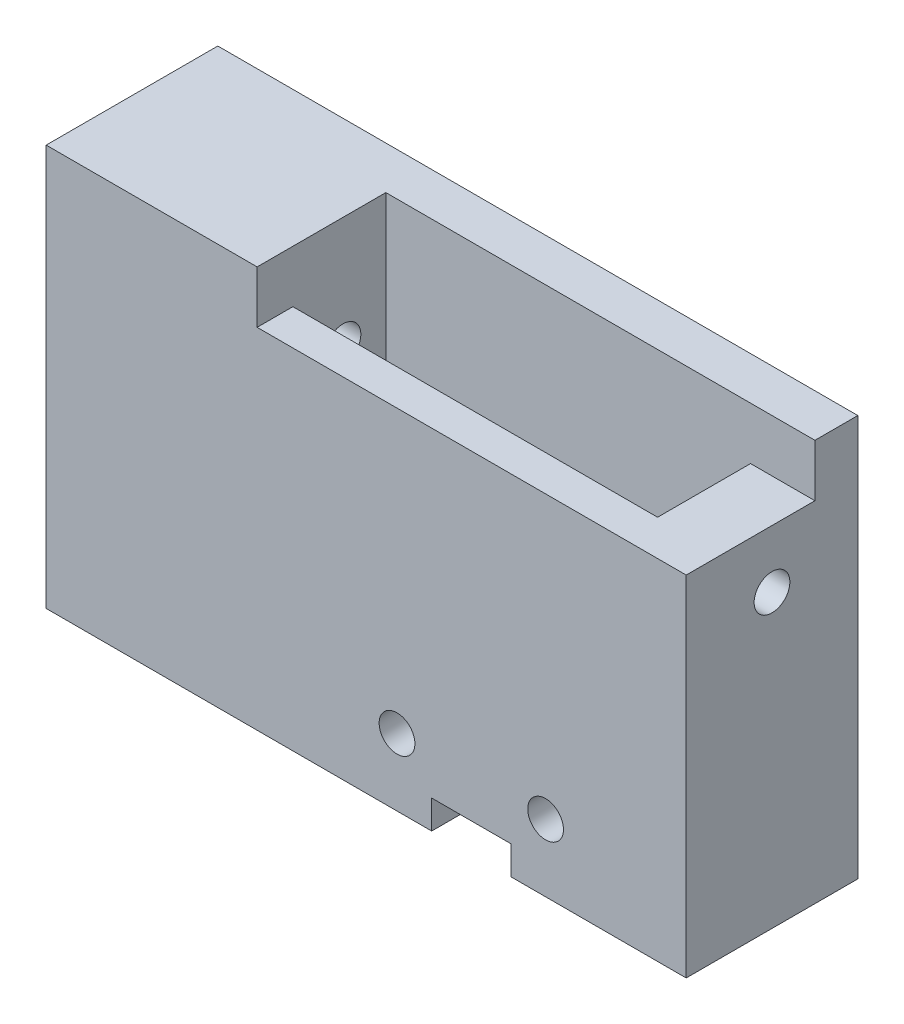
from build123d import *

# Parameters (mm, degrees)
SKETCH1_W              = 30
SKETCH1_H              = 24.4
BOSS_EXTRUDE1_DEPTH    = 3
SKETCH1_5_R            = 1.25
CUT_EXTRUDE1_DEPTH     = 6
BOSS_EXTRUDE3_START    = -3
BOSS_EXTRUDE3_DEPTH    = 3
SKETCH1_6_W            = 4.5
SKETCH1_6_H            = 11
SKETCH1_6_H_2          = 24.4
BOSS_EXTRUDE4_DEPTH    = 9
BOSS_EXTRUDE5_START    = -3
SKETCH2_6_W            = 14.75
SKETCH2_6_H            = 28.06
BOSS_EXTRUDE5_DEPTH    = 9
CUT_REVOLVE1_OUTLINE_W = 1.25
CUT_REVOLVE1_OUTLINE_H = 4.5
BOSS_EXTRUDE7_START    = 9
SKETCH1_7_W            = 2.25
SKETCH1_7_H            = 2
SKETCH1_7_W_2          = 6.505
SKETCH1_7_W_3          = 1.2
SKETCH1_7_W_4          = 6.495
SKETCH1_7_W_5          = 1.25
SKETCH1_7_R            = 1.25
BOSS_EXTRUDE7_DEPTH    = 2.5


# Read off the part's stored shape, not the designer's step: Cut-Revolve1
with BuildPart() as part:
    # Sketch1 → Boss-Extrude1 (new body)
    with BuildSketch(Plane.XY):
        with Locations((5.22, 7.5)):
            Rectangle(SKETCH1_W, SKETCH1_H)
    extrude(amount=-BOSS_EXTRUDE1_DEPTH)

    # Sketch1<5> → Cut-Extrude1 (cut)
    with BuildSketch(Plane.XY):
        Circle(SKETCH1_5_R)
        with Locations((10.39, 0)):
            Circle(SKETCH1_5_R)
    extrude(amount=-CUT_EXTRUDE1_DEPTH, mode=Mode.SUBTRACT)

    # Sketch2 → Boss-Extrude3 (add)
    with BuildSketch(Plane.XY.offset(3).offset(BOSS_EXTRUDE3_START)):
        Polygon((-9.78, -4.7), (-9.78, 16.91), (-4.78, 16.91), (-4.78, 19.7), (20.22, 19.7), (20.22, 23.36), (-24.53, 23.36), (-24.53, -4.7), align=None)
    extrude(amount=-BOSS_EXTRUDE3_DEPTH)

    # Sketch1<6> → Boss-Extrude4 (add)
    with BuildSketch(Plane.XY):
        with Locations((-7.53, 0.8)):
            Rectangle(SKETCH1_6_W, SKETCH1_6_H)
        with Locations((17.97, 7.5)):
            Rectangle(SKETCH1_6_W, SKETCH1_6_H_2)
    extrude(amount=BOSS_EXTRUDE4_DEPTH)

    # Sketch2<6> → Boss-Extrude5 (add)
    with BuildSketch(Plane.XY.offset(3).offset(BOSS_EXTRUDE5_START)):
        with Locations((-17.155, 9.33)):
            Rectangle(SKETCH2_6_W, SKETCH2_6_H)
    extrude(amount=BOSS_EXTRUDE5_DEPTH)

    # Cut-Revolve1 outline → Cut-Revolve1 (revolve, cut)
    with BuildSketch(Plane(origin=(0, 15.66, 3), x_dir=(0, 1, 0), z_dir=(0, 0, -1))):
        Polygon((5, -24.53), (5, -18.53), (1.25, -14.78), (1.25, -9.78), (0, -9.78), (0, -24.53), align=None)
        with Locations((0.625, 17.97)):
            Rectangle(CUT_REVOLVE1_OUTLINE_W, CUT_REVOLVE1_OUTLINE_H)
    revolve(axis=Axis((0, 15.66, 3), (1, 0, 0)), mode=Mode.SUBTRACT)

    # Sketch1<7> → Boss-Extrude7 (add)
    # profile 1 of 9: a face of its own
    with BuildSketch(Plane.XY.offset(BOSS_EXTRUDE7_START)):
        Polygon((-9.78, 19.7), (-9.78, 9.7), (13.47, 9.7), (15.72, 9.7), (15.72, 19.7), align=None)
    # profile 2 of 9: a face of its own
    with BuildSketch(Plane.XY.offset(BOSS_EXTRUDE7_START)):
        Polygon((13.47, 9.7), (-9.78, 9.7), (-9.78, 7.8), (-5.28, 7.8), (-5.28, 7.4), (-5.28, -2.7), (15.72, -2.7), (15.72, 7.7), (13.47, 7.7), align=None)
        with BuildLine():
            Line((-5.08, -2), (-5.08, 6.2))
            ThreePointArc((-5.08, 6.2), (-4.787106781, 6.907106781), (-4.08, 7.2))
            Line((-4.08, 7.2), (3.92, 7.2))
            Line((3.92, 7.2), (3.92, 7.5))
            Line((3.92, 7.5), (14.47, 7.5))
            ThreePointArc((14.47, 7.5), (15.177106781, 7.207106781), (15.47, 6.5))
            Line((15.47, 6.5), (15.47, -2))
            ThreePointArc((15.47, -2), (15.323553391, -2.353553391), (14.97, -2.5))
            Line((14.97, -2.5), (-4.58, -2.5))
            ThreePointArc((-4.58, -2.5), (-4.933553391, -2.353553391), (-5.08, -2))
        make_face(mode=Mode.SUBTRACT)
    # profile 3 of 9: a face of its own
    with BuildSketch(Plane.XY.offset(BOSS_EXTRUDE7_START)):
        Polygon((-5.28, 6.3), (-5.28, 7.4), (-5.28, 7.8), (-9.78, 7.8), (-9.78, 6.3), align=None)
    # profile 4 of 9: a face of its own
    with BuildSketch(Plane.XY.offset(BOSS_EXTRUDE7_START)):
        with Locations((14.595, 8.7)):
            Rectangle(SKETCH1_7_W, SKETCH1_7_H)
    # profile 5 of 9: a face of its own
    with BuildSketch(Plane.XY.offset(BOSS_EXTRUDE7_START)):
        with Locations((-0.8275, -3.7)):
            Rectangle(SKETCH1_7_W_2, SKETCH1_7_H)
    # profile 6 of 9: a face of its own
    with BuildSketch(Plane.XY.offset(BOSS_EXTRUDE7_START)):
        with Locations((-4.68, -3.7)):
            Rectangle(SKETCH1_7_W_3, SKETCH1_7_H)
    # profile 7 of 9: a face of its own
    with BuildSketch(Plane.XY.offset(BOSS_EXTRUDE7_START)):
        with Locations((11.2225, -3.7)):
            Rectangle(SKETCH1_7_W_4, SKETCH1_7_H)
    # profile 8 of 9: a face of its own
    with BuildSketch(Plane.XY.offset(BOSS_EXTRUDE7_START)):
        with Locations((15.095, -3.7)):
            Rectangle(SKETCH1_7_W_5, SKETCH1_7_H)
    # profile 9 of 9: a face of its own
    with BuildSketch(Plane.XY.offset(BOSS_EXTRUDE7_START)):
        with BuildLine():
            ThreePointArc((-5.08, 6.2), (-4.787106781, 6.907106781), (-4.08, 7.2))
            Line((-4.08, 7.2), (3.92, 7.2))
            Line((3.92, 7.2), (3.92, 7.5))
            Line((3.92, 7.5), (14.47, 7.5))
            ThreePointArc((14.47, 7.5), (15.177106781, 7.207106781), (15.47, 6.5))
            Line((15.47, 6.5), (15.47, -2))
            ThreePointArc((15.47, -2), (15.323553391, -2.353553391), (14.97, -2.5))
            Line((14.97, -2.5), (-4.58, -2.5))
            ThreePointArc((-4.58, -2.5), (-4.933553391, -2.353553391), (-5.08, -2))
            Line((-5.08, -2), (-5.08, 6.2))
        make_face()
        with Locations((10.39, 0)):
            Circle(SKETCH1_7_R, mode=Mode.SUBTRACT)
        Circle(SKETCH1_7_R, mode=Mode.SUBTRACT)
    extrude(amount=-BOSS_EXTRUDE7_DEPTH)


solid = part.part
